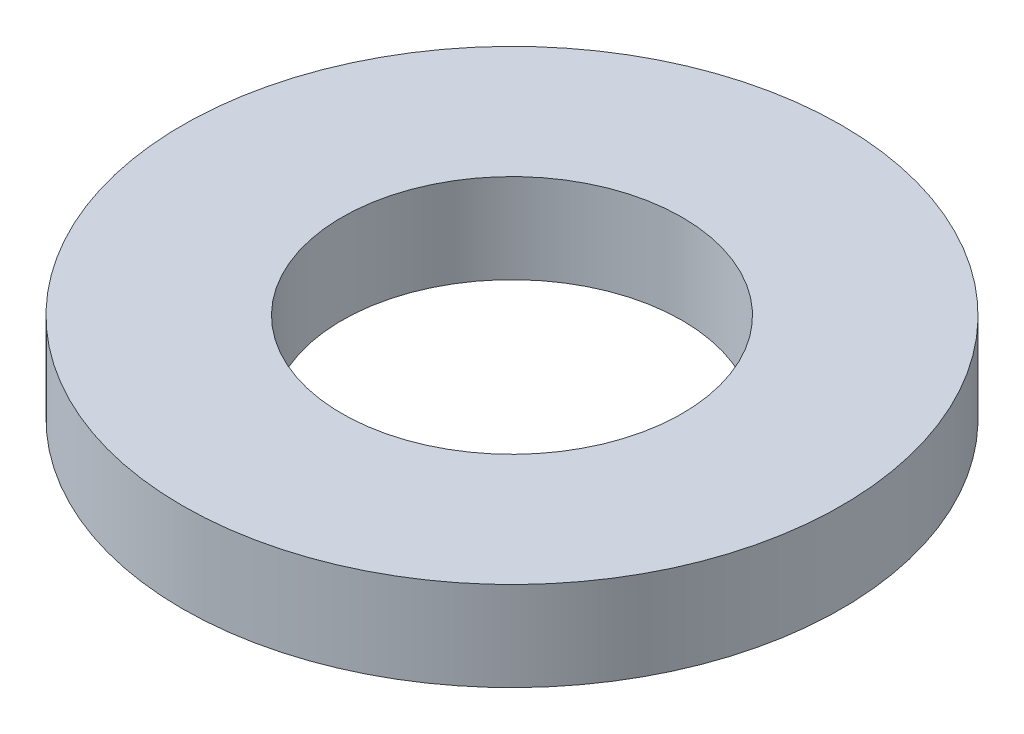
from build123d import *

# Parameters (mm, degrees)
SKETCH1_R           = 77.5
BOSS_EXTRUDE1_DEPTH = 21
SKETCH2_R           = 40
CUT_EXTRUDE1_DEPTH  = 112.595250795


with BuildPart() as part:
    # Sketch1 → Boss-Extrude1 (new body)
    with BuildSketch(Plane(origin=(0, 0, 0), x_dir=(1, 0, 0), z_dir=(0, 1, 0))):
        Circle(SKETCH1_R)
    extrude(amount=BOSS_EXTRUDE1_DEPTH)

    # Sketch2 → Cut-Extrude1 (cut, through all)
    with BuildSketch(Plane(origin=(0, 0, 0), x_dir=(1, 0, 0), z_dir=(0, 1, 0))):
        Circle(SKETCH2_R)
    extrude(amount=CUT_EXTRUDE1_DEPTH, mode=Mode.SUBTRACT)


solid = part.part
